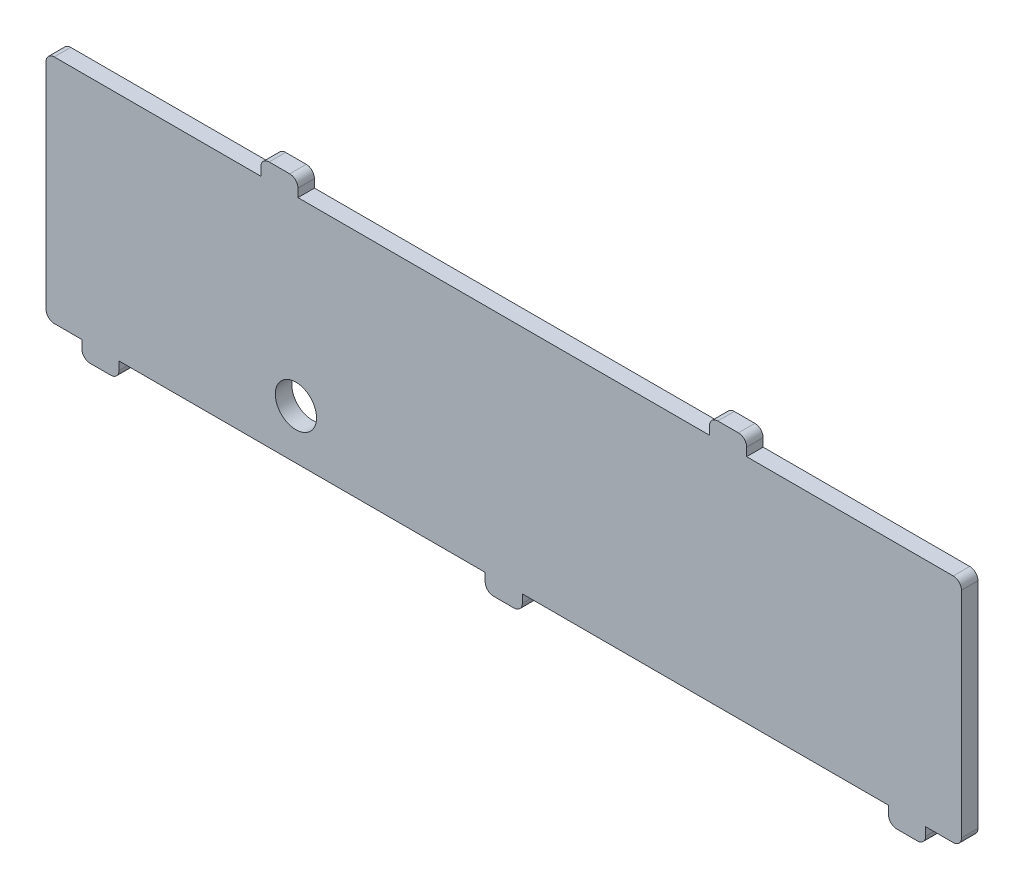
from build123d import *

# Parameters (mm, degrees)
BOSS_EXTRUDE1_DEPTH = 1
FILLET1_R           = 1
CUT_EXTRUDE1_REACH  = 59.795
SKETCH3_R           = 2.5


with BuildPart() as part:
    # Sketch1 → Boss-Extrude1 (new, symmetric)
    with BuildSketch(Plane.XY):
        Polygon((-29.45, 14), (-55.5, 14), (-55.5, -14), (-51.15, -14), (-51.15, -16), (-46.65, -16), (-46.65, -14), (-2.25, -14), (-2.25, -16), (2.25, -16), (2.25, -14), (46.65, -14), (46.65, -16), (51.15, -16), (51.15, -14), (55.5, -14), (55.5, 14), (29.45, 14), (29.45, 16), (24.95, 16), (24.95, 14), (-24.95, 14), (-24.95, 16), (-29.45, 16), align=None)
    extrude(amount=BOSS_EXTRUDE1_DEPTH, both=True)

    # Fillet1
    fillet1_edges = [part.edges().sort_by_distance(p)[0] for p in [
        (-55.5, 14, 0),
        (-55.5, -14, 0),
        (-46.65, -16, 0),
        (-51.15, -16, 0),
        (2.25, -16, 0),
        (-2.25, -16, 0),
        (46.65, -16, 0),
        (51.15, -16, 0),
        (55.5, -14, 0),
        (55.5, 14, 0),
        (29.45, 16, 0),
        (24.95, 16, 0),
        (-24.95, 16, 0),
        (-29.45, 16, 0),
    ]]
    fillet(fillet1_edges, radius=FILLET1_R)

    # Sketch3 → Cut-Extrude1 (cut, up to next)
    with BuildSketch(Plane.XY.offset(1), mode=Mode.PRIVATE) as cut_extrude1_sk1:
        with Locations((-25.2, -8)):
            Circle(SKETCH3_R)
    cut_extrude1_tool1 = extrude(cut_extrude1_sk1.sketch, amount=-CUT_EXTRUDE1_REACH, mode=Mode.PRIVATE) & part.part
    add(cut_extrude1_tool1.solids().sort_by_distance((-25.2, -8, 1))[0], mode=Mode.SUBTRACT)


solid = part.part
